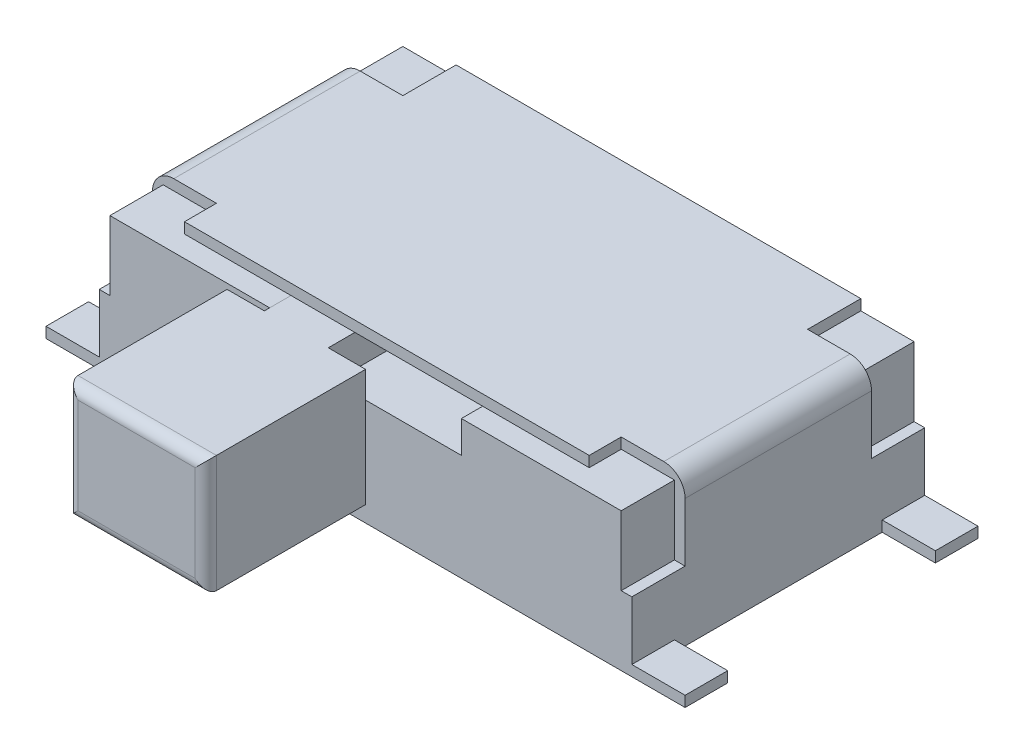
from build123d import *

# Parameters (mm, degrees)
SKETCH_1_W          = 4.8
SKETCH_1_H          = 2.75
EXTRUDE_1_DEPTH     = 1.3
EXTRUDE_3_DEPTH     = 0.1
EXTRUDE_4_DEPTH     = 0.1
SKETCH_4_W          = 0.4
SKETCH_4_H          = 0.1
EXTRUDE_5_DEPTH     = 0.5
SKETCH_5_W          = 3.8
SKETCH_5_H          = 0.2
CUT_EXTRUDE_1_DEPTH = 0.1
SKETCH_6_W          = 1.8
SKETCH_6_H          = 0.3
CUT_EXTRUDE_2_DEPTH = 1
SKETCH_7_W          = 0.6
SKETCH_7_H          = 0.3
EXTRUDE_6_DEPTH     = 1.05
SKETCH_8_W          = 1.3
SKETCH_8_H          = 1.1
EXTRUDE_7_DEPTH     = 1.5
SKETCH_9_W          = 0.4
SKETCH_9_H          = 0.15
EXTRUDE_8_DEPTH     = 0.9
FILLET_1_R          = 0.2
FILLET_2_R          = 0.1
SKETCH_10_R         = 0.3815
EXTRUDE_9_DEPTH     = 0.5
FILLET_3_R          = 0.2


with BuildPart() as part:
    # 草图1 → 凸台-拉伸1 (new body)
    with BuildSketch(Plane(origin=(0, 0, 0), x_dir=(1, 0, 0), z_dir=(0, 1, 0))):
        with Locations((2.4, 1.375)):
            Rectangle(SKETCH_1_W, SKETCH_1_H)
    extrude(amount=EXTRUDE_1_DEPTH)



with BuildPart() as body_2:
    # 草图2 → 凸台-拉伸3 (new body)
    with BuildSketch(Plane(origin=(0, 1.3, 0), x_dir=(1, 0, 0), z_dir=(0, 1, 0))):
        Polygon((-0.1, 0.5), (0.5, 0.5), (0.5, 0), (4.3, 0), (4.3, 0.5), (4.9, 0.5), (4.9, 2.25), (4.3, 2.25), (4.3, 2.75), (0.5, 2.75), (0.5, 2.25), (-0.1, 2.25), align=None)
    extrude(amount=EXTRUDE_3_DEPTH)


with BuildPart() as part_1:
    add(part.part)

    add(body_2.part)  # 凸台-拉伸4 merges body 2
    # 草图3 → 凸台-拉伸4 (add)
    with BuildSketch(Plane.ZY):
        Polygon((-2.75, 0), (0, 0), (0, 0.65), (-0.5, 0.65), (-0.5, 1.3), (-2.25, 1.3), (-2.25, 0.65), (-2.75, 0.65), align=None)
    extrude(amount=EXTRUDE_4_DEPTH)


with BuildPart() as body_2_2:
    # 镜向16: mirrored copy
    add(part_1.part.mirror(Plane(origin=(2.4, 0, 0), x_dir=(0, 0, 1), z_dir=(1, 0, 0))))


with BuildPart() as part_2:
    add(part_1.part)

    add(body_2_2.part)  # 凸台-拉伸5 merges body 2 2
    # 草图4 → 凸台-拉伸5 (add)
    with BuildSketch(Plane.ZY.offset(0.1)):
        with Locations((-2.55, 0.05)):
            Rectangle(SKETCH_4_W, SKETCH_4_H)
        with Locations((-0.2, 0.05)):
            Rectangle(SKETCH_4_W, SKETCH_4_H)
    extrude(amount=EXTRUDE_5_DEPTH)

    # 镜向17: part across plane


with BuildPart() as part_3:
    add(part_2.part)
    add(part_2.part.mirror(Plane(origin=(2.4, 0, 0), x_dir=(0, 0, 1), z_dir=(1, 0, 0))))

    # 草图5 → 切除-拉伸1 (cut)
    with BuildSketch(Plane(origin=(0, 1.4, 0), x_dir=(1, 0, 0), z_dir=(0, 1, 0))):
        with Locations((2.4, 0.1)):
            Rectangle(SKETCH_5_W, SKETCH_5_H)
    extrude(amount=-CUT_EXTRUDE_1_DEPTH, mode=Mode.SUBTRACT)

    # 草图6 → 切除-拉伸2 (cut)
    with BuildSketch(Plane.XY):
        with Locations((2.4, 1.15)):
            Rectangle(SKETCH_6_W, SKETCH_6_H)
    extrude(amount=-CUT_EXTRUDE_2_DEPTH, mode=Mode.SUBTRACT)

    # 草图9 → 凸台-拉伸8 (add)
    with BuildSketch(Plane(origin=(0, 0, -2.75), x_dir=(-1, 0, 0), z_dir=(0, 0, -1))):
        with Locations((-1.4, 0.075)):
            Rectangle(SKETCH_9_W, SKETCH_9_H)
        with Locations((-2.4, 0.075)):
            Rectangle(SKETCH_9_W, SKETCH_9_H)
        with Locations((-3.4, 0.075)):
            Rectangle(SKETCH_9_W, SKETCH_9_H)
    extrude(amount=EXTRUDE_8_DEPTH)

    # 圆角1
    fillet_1_edges = [part_3.edges().sort_by_distance(p)[0] for p in [
        (4.9, 1.4, -1.375),
        (-0.1, 1.4, -1.375),
    ]]
    fillet(fillet_1_edges, radius=FILLET_1_R)

    # 草图10 → 凸台-拉伸9 (add)
    with BuildSketch(Plane.XZ):
        with Locations((0.9, -1.375)):
            Circle(SKETCH_10_R)
        with Locations((3.9, -1.375)):
            Circle(SKETCH_10_R)
    extrude(amount=EXTRUDE_9_DEPTH)

    # 圆角3
    fillet_3_edges = [part_3.edges().sort_by_distance(p)[0] for p in [
        (3.5185, -0.5, -1.375),
        (0.5185, -0.5, -1.375),
    ]]
    fillet(fillet_3_edges, radius=FILLET_3_R)


with BuildPart() as body_2_3:
    # 草图7 → 凸台-拉伸6 (new body)
    with BuildSketch(Plane.XY.offset(-1)):
        with Locations((1.8, 1.15)):
            Rectangle(SKETCH_7_W, SKETCH_7_H)
    extrude(amount=EXTRUDE_6_DEPTH)

    # 草图8 → 凸台-拉伸7 (add)
    with BuildSketch(Plane.XY.offset(0.05)):
        with Locations((1.8, 0.75)):
            Rectangle(SKETCH_8_W, SKETCH_8_H)
    extrude(amount=EXTRUDE_7_DEPTH)

    # 圆角2
    fillet_2_edges = [body_2_3.edges().sort_by_distance(p)[0] for p in [
        (1.8, 1.3, 1.55),
        (2.45, 0.75, 1.55),
        (1.8, 0.2, 1.55),
        (1.15, 0.75, 1.55),
    ]]
    fillet(fillet_2_edges, radius=FILLET_2_R)


solid = Compound([part_3.part, body_2_3.part])
